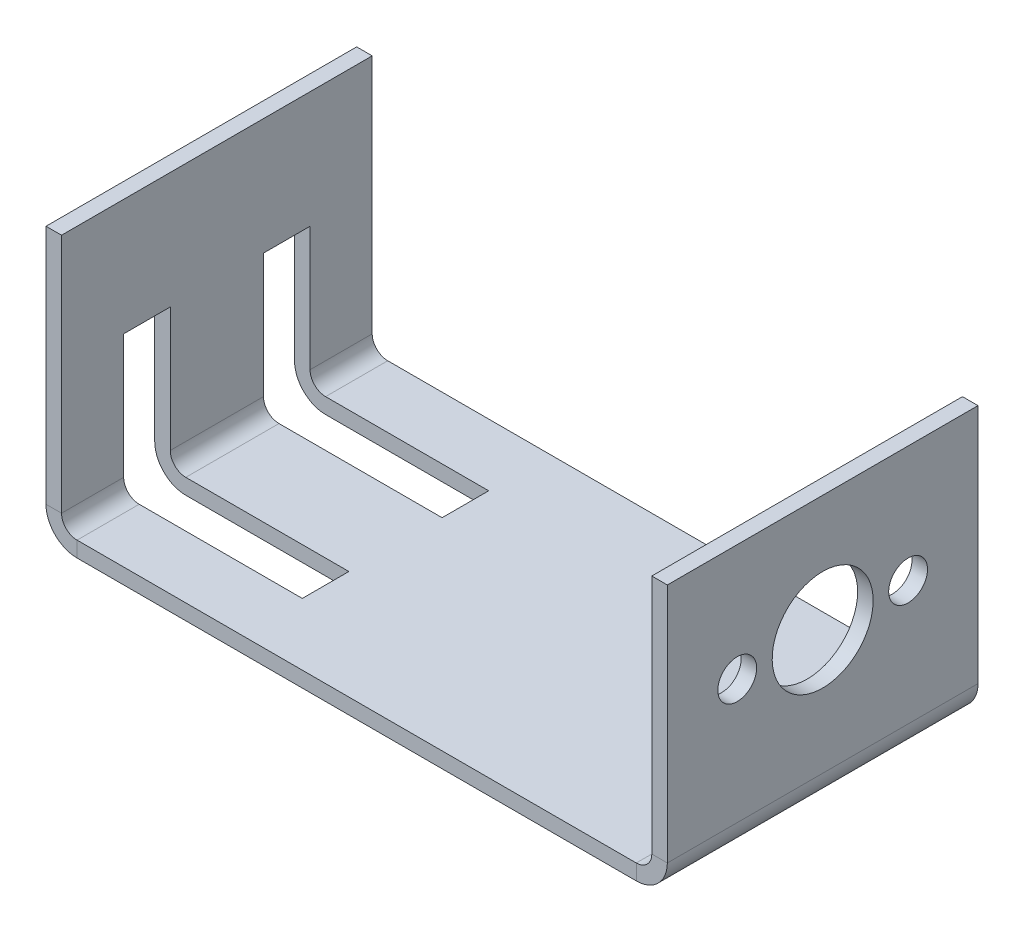
from build123d import *

# Parameters (mm, degrees)
SKETCH1_W                      = 80
SKETCH1_H                      = 40
BASE_FLANGE1_DEPTH             = 2
EDGE_FLANGE1_STRIP_W           = 12
EDGE_FLANGE1_STRIP_H           = 2
EDGE_FLANGE1_STRIP_CUT_DEPTH   = 40
EDGE_FLANGE1_STRIP_2_W         = 12
EDGE_FLANGE1_STRIP_2_H         = 2
EDGE_FLANGE1_STRIP_CUT_2_DEPTH = 40
EDGE_FLANGE1_DEPTH             = 40
EDGE_FLANGE1_BEND_DEPTH        = 40
SKETCH12_R                     = 6.5
SKETCH12_R_2                   = 2.5
CUT_EXTRUDE1_DEPTH             = 10
SKETCH13_W                     = 6
SKETCH13_H                     = 40
CUT_EXTRUDE2_DEPTH             = 25


# Sheet-metal steps are written as plain solids
with BuildPart() as part:
    # Sketch1 → Base-Flange1 (new body)
    with BuildSketch(Plane(origin=(0, 0, 0), x_dir=(1, 0, 0), z_dir=(0, 1, 0))):
        Rectangle(SKETCH1_W, SKETCH1_H)
    extrude(amount=-BASE_FLANGE1_DEPTH)

    # Edge-Flange1 strip (across the edge) → Edge-Flange1 strip cut (cut)
    with BuildSketch(Plane(origin=(-40, 0, -20), x_dir=(1, 0, 0), z_dir=(0, 0, 1))):
        with Locations((-2, -1)):
            Rectangle(EDGE_FLANGE1_STRIP_W, EDGE_FLANGE1_STRIP_H)
    extrude(amount=EDGE_FLANGE1_STRIP_CUT_DEPTH, mode=Mode.SUBTRACT)

    # Edge-Flange1 strip 2 (across the edge) → Edge-Flange1 strip cut 2 (cut)
    with BuildSketch(Plane(origin=(40, 0, 20), x_dir=(-1, 0, 0), z_dir=(0, 0, -1))):
        with Locations((-2, -1)):
            Rectangle(EDGE_FLANGE1_STRIP_2_W, EDGE_FLANGE1_STRIP_2_H)
    extrude(amount=EDGE_FLANGE1_STRIP_CUT_2_DEPTH, mode=Mode.SUBTRACT)

    # Edge-Flange1 section (across the edge) → Edge-Flange1 (add)
    with BuildSketch(Plane(origin=(-40, 0, -20), x_dir=(1, 0, 0), z_dir=(0, 0, 1))):
        with BuildLine():
            Line((0, 2), (0, 33))
            Line((0, 33), (2, 33))
            Line((2, 33), (2, 2))
            ThreePointArc((2, 2), (2.585786438, 0.585786438), (4, 0))
            Line((4, 0), (4, -2))
            ThreePointArc((4, -2), (1.171572875, -0.828427125), (0, 2))
        make_face()
    extrude(amount=EDGE_FLANGE1_DEPTH)

    # Edge-Flange1 section 2 (across the edge) → Edge-Flange1 bend (add)
    with BuildSketch(Plane(origin=(40, 0, 20), x_dir=(-1, 0, 0), z_dir=(0, 0, -1))):
        with BuildLine():
            Line((0, 2), (0, 33))
            Line((0, 33), (2, 33))
            Line((2, 33), (2, 2))
            ThreePointArc((2, 2), (2.585786438, 0.585786438), (4, 0))
            Line((4, 0), (4, -2))
            ThreePointArc((4, -2), (1.171572875, -0.828427125), (0, 2))
        make_face()
    extrude(amount=EDGE_FLANGE1_BEND_DEPTH)

    # Sketch12 → Cut-Extrude1 (cut)
    with BuildSketch(Plane(origin=(40, 0, 0), x_dir=(0, 0, -1), z_dir=(1, 0, 0))):
        with Locations(Location((0, 18, 0), (0, 0, 90))):
            Circle(SKETCH12_R)
        with Locations(Location((-11, 18, 0), (0, 0, 90))):
            Circle(SKETCH12_R_2)
        with Locations(Location((11, 18, 0), (0, 0, 270))):
            Circle(SKETCH12_R_2)
    extrude(amount=-CUT_EXTRUDE1_DEPTH, mode=Mode.SUBTRACT)

    # Sketch13 → Cut-Extrude2 (cut)
    with BuildSketch(Plane.ZY.offset(40)):
        with Locations((9, -2)):
            Rectangle(SKETCH13_W, SKETCH13_H)
        with Locations((-9, -2)):
            Rectangle(SKETCH13_W, SKETCH13_H)
    extrude(amount=-CUT_EXTRUDE2_DEPTH, mode=Mode.SUBTRACT)


solid = part.part
